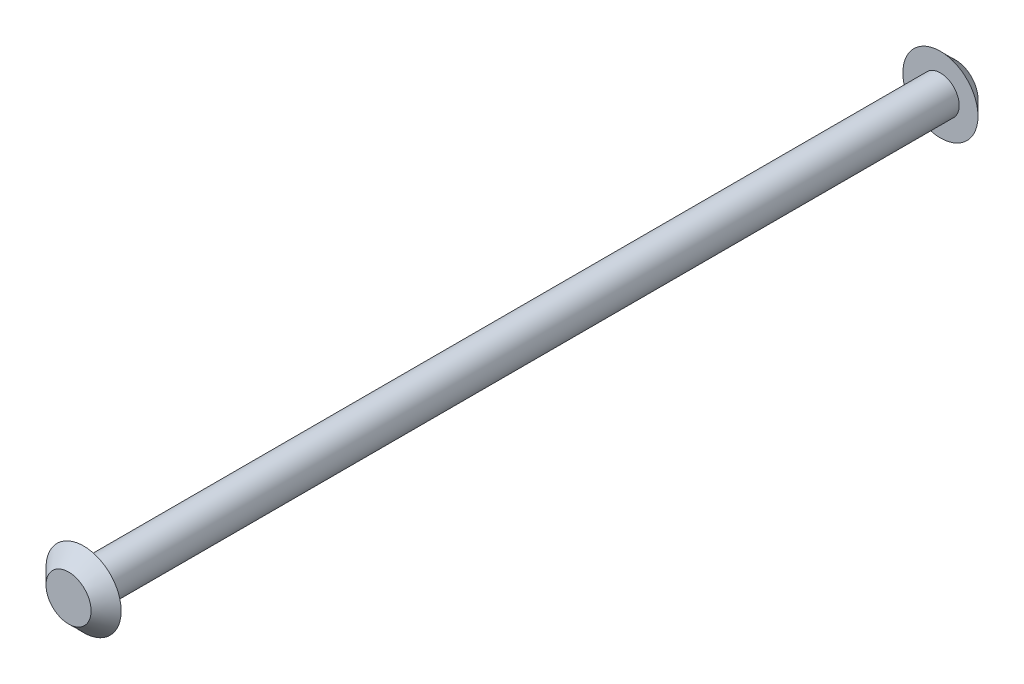
from build123d import *

# Parameters (mm, degrees)
SKETCH1_R                = 3.175
BOSS_EXTRUDE1_DEPTH      = 144.78
SKETCH2_R                = 6.35
BOSS_EXTRUDE2_DEPTH      = 2.54
CHAMFER1_SIZE            = 2.54
CHAMFER1_OF_MIRROR1_SIZE = 2.54


with BuildPart() as part:
    # Sketch1 → Boss-Extrude1 (new body)
    with BuildSketch(Plane.XY):
        Circle(SKETCH1_R)
    extrude(amount=BOSS_EXTRUDE1_DEPTH)

    # Sketch2 → Boss-Extrude2 (add)
    with BuildSketch(Plane.XY.offset(144.78)):
        Circle(SKETCH2_R)
    boss_extrude2 = extrude(amount=BOSS_EXTRUDE2_DEPTH)

    # Chamfer1
    chamfer1_edges = [part.edges().sort_by_distance(p)[0] for p in [
        (-6.35, 0, 147.32),
    ]]
    chamfer(chamfer1_edges, length=CHAMFER1_SIZE - 0.0001)  # a hair under: the kernel refuses the full size

    # Mirror1: Boss-Extrude2 across plane
    add(boss_extrude2.mirror(Plane(origin=(0, 0, 72.39), x_dir=(1, 0, 0), z_dir=(0, 0, -1))))

    # Chamfer1 of Mirror1
    chamfer1_of_mirror1_edges = [part.edges().sort_by_distance(p)[0] for p in [
        (-6.35, 0, -2.54),
    ]]
    chamfer(chamfer1_of_mirror1_edges, length=CHAMFER1_OF_MIRROR1_SIZE - 0.0001)  # a hair under: the kernel refuses the full size


solid = part.part
